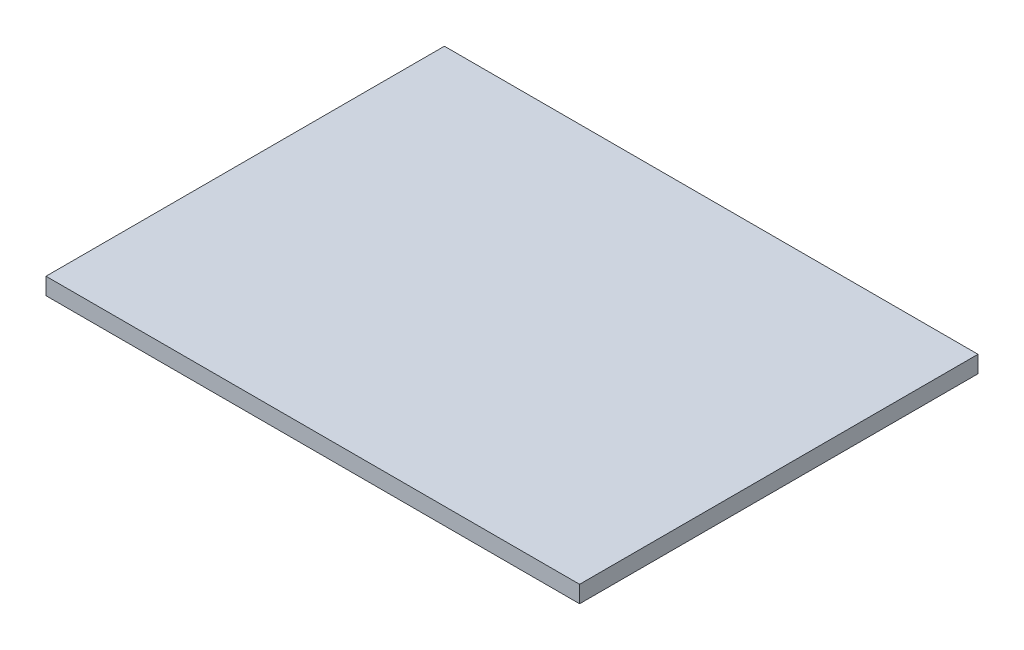
from build123d import *

# Parameters (mm, degrees)
SKETCH_2_W      = 300
SKETCH_2_H      = 224
EXTRUDE_1_DEPTH = 9.5


with BuildPart() as part:
    # 草图2 → 凸台-拉伸1 (new body)
    with BuildSketch(Plane(origin=(0, 0, 0), x_dir=(1, 0, 0), z_dir=(0, 1, 0))):
        Rectangle(SKETCH_2_W, SKETCH_2_H)
    extrude(amount=EXTRUDE_1_DEPTH)


solid = part.part
